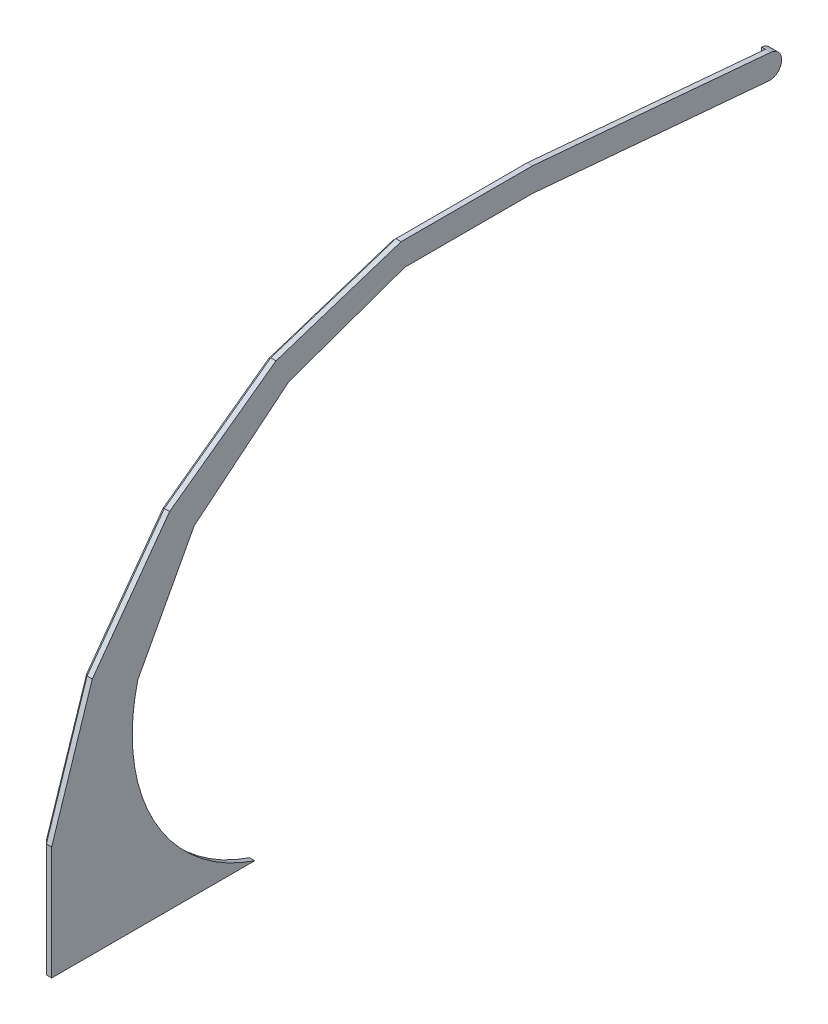
from build123d import *

# Parameters (mm, degrees)
BOSS_EXTRUDE1_DEPTH = 4.4
BOSS_EXTRUDE2_DEPTH = 3.2


with BuildPart() as part:
    # Sketch1 → Boss-Extrude1 (new body)
    with BuildSketch(Plane(origin=(0, 0, 0), x_dir=(0, 0, -1), z_dir=(1, 0, 0))):
        with BuildLine():
            Line((12.615293263, -92.633282396), (182.615293263, -92.633282396))
            ThreePointArc((182.615293263, -92.633282396), (98.271459614, -21.762843967), (84.825943994, 87.579368501))
            Line((84.825943994, 87.579368501), (131.929787104, 175.483372313))
            Line((131.929787104, 175.483372313), (210.884858569, 240.150484061))
            Line((210.884858569, 240.150484061), (308.236471933, 274.689971372))
            Line((308.236471933, 274.689971372), (415.1194685, 274.721469403))
            Line((415.1194685, 274.721469403), (612.615293263, 257.442823643))
            ThreePointArc((612.615293263, 257.442823643), (623.448797672, 266.533213196), (614.358408118, 277.366717604))
            Line((614.358408118, 277.366717604), (415.1194685, 294.797866154))
            Line((415.1194685, 294.797866154), (305.051694272, 294.797866154))
            Line((305.051694272, 294.797866154), (200.371020359, 260.785053385))
            Line((200.371020359, 260.785053385), (111.324320476, 196.088838941))
            Line((111.324320476, 196.088838941), (46.628106033, 107.042139058))
            Line((46.628106033, 107.042139058), (12.615293263, 2.361465145))
            Line((12.615293263, 2.361465145), (12.615293263, -92.633282396))
        make_face()
    extrude(amount=-BOSS_EXTRUDE1_DEPTH)

    # Sketch2 → Boss-Extrude2 (add)
    with BuildSketch(Plane.ZY.offset(4.4)):
        with BuildLine():
            Line((-614.358408118, 277.366717604), (-614.079509741, 274.178894571))
            Line((-614.079509741, 274.178894571), (-415.1194685, 291.585642674))
            Line((-415.1194685, 291.585642674), (-305.56046049, 291.585642674))
            Line((-305.56046049, 291.585642674), (-201.847517431, 257.88726472))
            Line((-201.847517431, 257.88726472), (-113.624018581, 193.789140836))
            Line((-113.624018581, 193.789140836), (-49.525894698, 105.565641986))
            Line((-49.525894698, 105.565641986), (-15.992890086, 2.361665742))
            Line((-15.992890086, 2.361665742), (-15.992890086, -92.633282396))
            Line((-15.992890086, -92.633282396), (-101.905821199, -92.633282396))
            Line((-101.905821199, -92.633282396), (-66.350301443, 2.364656501))
            Line((-66.350301443, 2.364656501), (-82.125101686, 88.955516392))
            Line((-82.125101686, 88.955516392), (-129.691126805, 177.722032612))
            Line((-129.691126805, 177.722032612), (-209.420903924, 243.023656826))
            Line((-209.420903924, 243.023656826), (-307.727729461, 277.902044928))
            Line((-307.727729461, 277.902044928), (-415.1194685, 277.933692883))
            Line((-415.1194685, 277.933692883), (-612.89419164, 260.630646676))
            Line((-612.89419164, 260.630646676), (-612.615293263, 257.442823643))
            ThreePointArc((-612.615293263, 257.442823643), (-623.448797672, 266.533213196), (-614.358408118, 277.366717604))
        make_face()
        Polygon((-573.682640638, 271.389097682), (-562.724498959, 272.347810853), (-562.35844484, 268.163793121), (-573.316586519, 267.20507995), align=None, mode=Mode.SUBTRACT)
        Polygon((-522.876711036, 275.834040563), (-511.918569357, 276.792753733), (-511.552515237, 272.608736001), (-522.510656916, 271.650022831), align=None, mode=Mode.SUBTRACT)
        Polygon((-619.14894859, 269.017422904), (-608.190806911, 269.976136075), (-607.824752791, 265.792118343), (-618.78289447, 264.833405172), align=None, mode=Mode.SUBTRACT)
    extrude(amount=BOSS_EXTRUDE2_DEPTH)


solid = part.part
